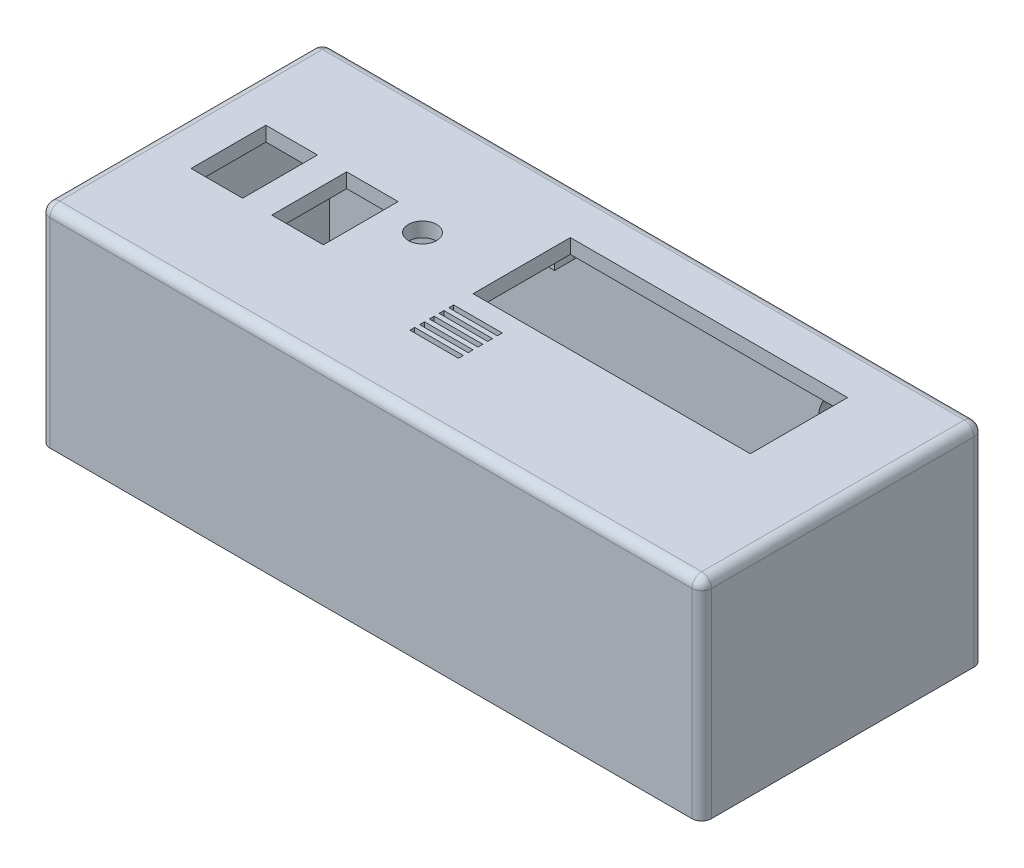
from build123d import *

# Parameters (mm, degrees)
SKETCH1_W           = 172.72
SKETCH1_H           = 73.66
SKETCH1_R           = 3.683
SKETCH1_W_2         = 72.39
SKETCH1_H_2         = 25.4
SKETCH1_W_3         = 13.462
SKETCH1_H_3         = 19.558
BOSS_EXTRUDE1_DEPTH = 3.81
BOSS_EXTRUDE2_DEPTH = 3.81
SKETCH3_R           = 1.9685
CUT_EXTRUDE1_DEPTH  = 6.35
SKETCH4_W           = 172.72
SKETCH4_H           = 73.66
SKETCH4_W_2         = 165.1
SKETCH4_H_2         = 67.945
BOSS_EXTRUDE4_DEPTH = 50.8
FILLET1_R           = 2.54
SKETCH5_W           = 10.16
SKETCH5_H           = 10.16
BOSS_EXTRUDE5_DEPTH = 6.35
FILLET2_R           = 2.54
SKETCH6_R           = 1.9685
CUT_EXTRUDE2_DEPTH  = 6.35
SKETCH7_W           = 12.7
SKETCH7_H           = 1.27
CUT_EXTRUDE3_DEPTH  = 3.81
SKETCH8_R           = 9.525
CUT_EXTRUDE4_DEPTH  = 2.54
BOSS_EXTRUDE6_START = 6.35
SKETCH9_R           = 16.51
SKETCH9_R_2         = 9.525
BOSS_EXTRUDE6_DEPTH = 6.35
CHAMFER1_SIZE       = 6.35


with BuildPart() as part:
    # Sketch1 → Boss-Extrude1 (new body)
    with BuildSketch(Plane(origin=(0, 0, 0), x_dir=(1, 0, 0), z_dir=(0, 1, 0))):
        with Locations((86.36, 36.83)):
            Rectangle(SKETCH1_W, SKETCH1_H)
        with Locations(Location((57.023, 42.799, 0), (0, 0, 90))):
            Circle(SKETCH1_R, mode=Mode.SUBTRACT)
        with Locations((113.665, 48.26)):
            Rectangle(SKETCH1_W_2, SKETCH1_H_2, mode=Mode.SUBTRACT)
        with Locations((19.05, 36.83)):
            Rectangle(SKETCH1_W_3, SKETCH1_H_3, mode=Mode.SUBTRACT)
        with Locations((40.132, 36.83)):
            Rectangle(SKETCH1_W_3, SKETCH1_H_3, mode=Mode.SUBTRACT)
    extrude(amount=BOSS_EXTRUDE1_DEPTH)

    # Sketch2 → Boss-Extrude2 (add)
    with BuildSketch(Plane.XZ):
        with BuildLine():
            Line((70.1675, -37.465), (75.2475, -37.465))
            Line((75.2475, -37.465), (75.2475, -32.385))
            ThreePointArc((75.2475, -32.385), (66.575397552, -28.792897552), (70.1675, -37.465))
        make_face()
        with BuildLine():
            Line((70.1675, -59.055), (75.2475, -59.055))
            Line((75.2475, -59.055), (75.2475, -64.135))
            ThreePointArc((75.2475, -64.135), (66.575397552, -67.727102448), (70.1675, -59.055))
        make_face()
        with BuildLine():
            Line((152.0825, -32.385), (152.0825, -37.465))
            Line((152.0825, -37.465), (157.1625, -37.465))
            ThreePointArc((157.1625, -37.465), (160.754602448, -28.792897552), (152.0825, -32.385))
        make_face()
        with BuildLine():
            Line((152.0825, -64.135), (152.0825, -59.055))
            Line((152.0825, -59.055), (157.1625, -59.055))
            ThreePointArc((157.1625, -59.055), (160.754602448, -67.727102448), (152.0825, -64.135))
        make_face()
    extrude(amount=BOSS_EXTRUDE2_DEPTH)

    # Sketch3 → Cut-Extrude1 (cut)
    with BuildSketch(Plane.XZ.offset(3.81)):
        with Locations(Location((70.1675, -32.385, 0), (0, 0, 270))):
            Circle(SKETCH3_R)
        with Locations(Location((70.1675, -64.135, 0), (0, 0, 270))):
            Circle(SKETCH3_R)
        with Locations(Location((157.1625, -64.135, 0), (0, 0, 270))):
            Circle(SKETCH3_R)
        with Locations(Location((157.1625, -32.385, 0), (0, 0, 270))):
            Circle(SKETCH3_R)
    extrude(amount=-CUT_EXTRUDE1_DEPTH, mode=Mode.SUBTRACT)

    # Sketch4 → Boss-Extrude4 (add)
    with BuildSketch(Plane.XZ):
        with Locations((86.36, -36.83)):
            Rectangle(SKETCH4_W, SKETCH4_H)
        with Locations((86.36, -37.7825)):
            Rectangle(SKETCH4_W_2, SKETCH4_H_2, mode=Mode.SUBTRACT)
    extrude(amount=BOSS_EXTRUDE4_DEPTH)

    # Fillet1
    fillet1_edges = [part.edges().sort_by_distance(p)[0] for p in [
        (172.72, 3.81, -36.83),
        (86.36, 3.81, -73.66),
        (0, 3.81, -36.83),
        (0, -23.495, -73.66),
        (172.72, -23.495, -73.66),
        (172.72, -23.495, 0),
        (0, -23.495, 0),
        (86.36, 3.81, 0),
    ]]
    fillet(fillet1_edges, radius=FILLET1_R)

    # Sketch5 → Boss-Extrude5 (add)
    with BuildSketch(Plane.XZ.offset(50.8)):
        with Locations((8.89, -8.89)):
            Rectangle(SKETCH5_W, SKETCH5_H)
        with Locations((8.89, -66.675)):
            Rectangle(SKETCH5_W, SKETCH5_H)
        with Locations((163.83, -8.89)):
            Rectangle(SKETCH5_W, SKETCH5_H)
        with Locations((147.955, -66.675)):
            Rectangle(SKETCH5_W, SKETCH5_H)
    extrude(amount=-BOSS_EXTRUDE5_DEPTH)

    # Fillet2
    fillet2_edges = [part.edges().sort_by_distance(p)[0] for p in [
        (13.97, -47.625, -13.97),
        (13.97, -47.625, -61.595),
        (153.035, -47.625, -61.595),
        (142.875, -47.625, -61.595),
        (158.75, -47.625, -13.97),
    ]]
    fillet(fillet2_edges, radius=FILLET2_R)

    # Sketch6 → Cut-Extrude2 (cut)
    with BuildSketch(Plane.XZ.offset(50.8)):
        with Locations(Location((8.89, -66.675, 0), (0, 0, 270))):
            Circle(SKETCH6_R)
        with Locations(Location((8.89, -8.89, 0), (0, 0, 270))):
            Circle(SKETCH6_R)
        with Locations(Location((163.83, -8.89, 0), (0, 0, 270))):
            Circle(SKETCH6_R)
        with Locations(Location((147.955, -66.675, 0), (0, 0, 270))):
            Circle(SKETCH6_R)
    extrude(amount=-CUT_EXTRUDE2_DEPTH, mode=Mode.SUBTRACT)

    # Sketch7 → Cut-Extrude3 (cut)
    with BuildSketch(Plane(origin=(0, 3.81, 0), x_dir=(1, 0, 0), z_dir=(0, 1, 0))):
        with Locations((83.82, 29.845)):
            Rectangle(SKETCH7_W, SKETCH7_H)
        with Locations((83.82, 27.305)):
            Rectangle(SKETCH7_W, SKETCH7_H)
        with Locations((83.82, 24.765)):
            Rectangle(SKETCH7_W, SKETCH7_H)
        with Locations((83.82, 22.225)):
            Rectangle(SKETCH7_W, SKETCH7_H)
        with Locations((83.82, 19.685)):
            Rectangle(SKETCH7_W, SKETCH7_H)
    extrude(amount=-CUT_EXTRUDE3_DEPTH, mode=Mode.SUBTRACT)

    # Sketch8 → Cut-Extrude4 (cut)
    with BuildSketch(Plane(origin=(0, 0, -73.66), x_dir=(-1, 0, 0), z_dir=(0, 0, -1))):
        with Locations((-140.97, -15.621)):
            Circle(SKETCH8_R)
    extrude(amount=-CUT_EXTRUDE4_DEPTH, mode=Mode.SUBTRACT)

    # Sketch9 → Boss-Extrude6 (add)
    with BuildSketch(Plane(origin=(0, 0, -73.66), x_dir=(-1, 0, 0), z_dir=(0, 0, -1)).offset(BOSS_EXTRUDE6_START)):
        with Locations(Location((-140.97, -15.621, 0), (0, 0, 180))):
            Circle(SKETCH9_R)
        with Locations((-140.97, -15.621)):
            Circle(SKETCH9_R_2, mode=Mode.SUBTRACT)
    extrude(amount=-BOSS_EXTRUDE6_DEPTH)

    # Chamfer1
    chamfer1_edges = [part.edges().sort_by_distance(p)[0] for p in [
        (124.46, -15.621, -80.01),
    ]]
    chamfer(chamfer1_edges, length=CHAMFER1_SIZE - 0.0001)  # a hair under: the kernel refuses the full size


solid = part.part
